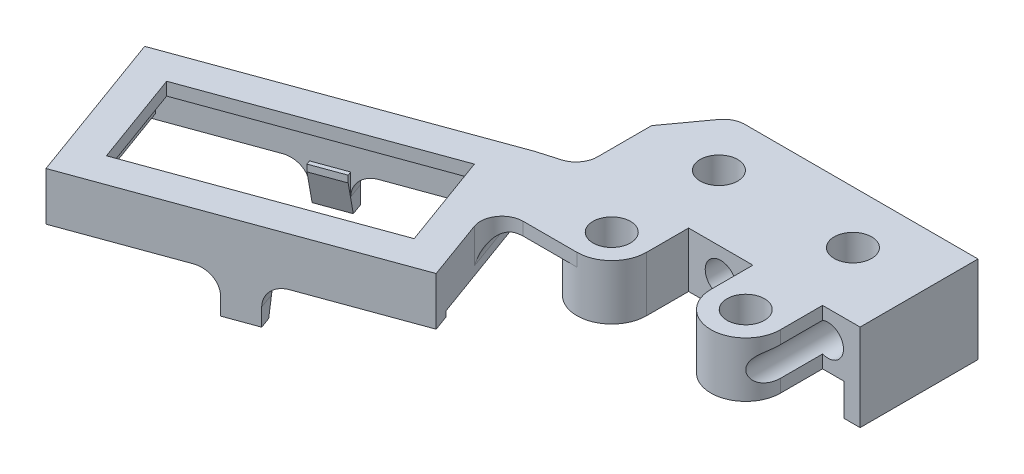
from build123d import *
from OCP.BRepFilletAPI import BRepFilletAPI_MakeChamfer

# Parameters (mm, degrees)
SKETCH1_R           = 1.7499999999999998
BOSS_EXTRUDE1_DEPTH = 5.13
CUT_EXTRUDE1_REACH  = 26.268
SKETCH2_R           = 1.45
BOSS_EXTRUDE2_DEPTH = 3
CUT_EXTRUDE2_REACH  = 20.262
CUT_EXTRUDE3_REACH  = 20.262
BOSS_EXTRUDE3_START = 1.2
BOSS_EXTRUDE3_DEPTH = 1.2
BOSS_EXTRUDE6_DEPTH = 3.3
BOSS_EXTRUDE7_DEPTH = 0.8
CUT_EXTRUDE4_DEPTH  = 0.5
CUT_EXTRUDE5_REACH  = 52.896
BOSS_EXTRUDE8_DEPTH = 2.83
FILLET1_R           = 2
CHAMFER1_SIZE       = 3
CHAMFER1_SIZE2      = 0.8038475772933701


with BuildPart() as part:
    # Sketch1 → Boss-Extrude1 (new body)
    with BuildSketch(Plane(origin=(0, 0, 0), x_dir=(1, 0, 0), z_dir=(0, 1, 0))):
        Polygon((12.999999999999998, 9.92), (-13.000000000000002, 9.92), (-13, -9.92), (13, -9.92), align=None)
        with Locations((-6.250000000000001, -5)):
            Circle(SKETCH1_R, mode=Mode.SUBTRACT)
        with Locations((6.250000000000003, -4.999999999999995)):
            Circle(SKETCH1_R, mode=Mode.SUBTRACT)
        with Locations((-6.250000000000001, 5)):
            Circle(SKETCH1_R, mode=Mode.SUBTRACT)
        with Locations((6.249999999999999, 4.999999999999998)):
            Circle(SKETCH1_R, mode=Mode.SUBTRACT)
    extrude(amount=BOSS_EXTRUDE1_DEPTH)

    # Sketch2 → Cut-Extrude1 (cut, up to next)
    with BuildSketch(Plane.XY.offset(9.92), mode=Mode.PRIVATE) as cut_extrude1_sk1:
        with Locations((0, 2.565)):
            Circle(SKETCH2_R)
    cut_extrude1_tool1 = extrude(cut_extrude1_sk1.sketch, amount=-CUT_EXTRUDE1_REACH, mode=Mode.PRIVATE) & part.part
    # Sketch2 → Cut-Extrude1 (cut, up to next)
    with BuildSketch(Plane.XY.offset(9.92), mode=Mode.PRIVATE) as cut_extrude1_sk2:
        with Locations((-10, 2.565)):
            Circle(SKETCH2_R)
    cut_extrude1_tool2 = extrude(cut_extrude1_sk2.sketch, amount=-CUT_EXTRUDE1_REACH, mode=Mode.PRIVATE) & part.part
    # Sketch2 → Cut-Extrude1 (cut, up to next)
    with BuildSketch(Plane.XY.offset(9.92), mode=Mode.PRIVATE) as cut_extrude1_sk3:
        with Locations((10, 2.565)):
            Circle(SKETCH2_R)
    cut_extrude1_tool3 = extrude(cut_extrude1_sk3.sketch, amount=-CUT_EXTRUDE1_REACH, mode=Mode.PRIVATE) & part.part
    add(cut_extrude1_tool1.solids().sort_by_distance((0, 2.565, 9.92))[0], mode=Mode.SUBTRACT)
    add(cut_extrude1_tool2.solids().sort_by_distance((-10, 2.565, 9.92))[0], mode=Mode.SUBTRACT)
    add(cut_extrude1_tool3.solids().sort_by_distance((10, 2.565, 9.92))[0], mode=Mode.SUBTRACT)

    # Sketch3 → Boss-Extrude2 (add)
    with BuildSketch(Plane.XZ):
        with BuildLine():
            Line((-13, -9.919999999999998), (-11.034999999999997, -9.919999999999998))
            Line((-11.034999999999997, -9.92), (-11.63, 3.710000000000001))
            add(Edge.make_bspline(
                [(-11.63, 3.7100000000000013), (-10.51224572230246, 4.466321985960096), (-10.92, 6.040000000000002)],
                knots=[0, 0, 0, 1, 1, 1], degree=2))
            Line((-10.92, 6.040000000000002), (-9.0061377245509, 9.92))
            Line((-9.0061377245509, 9.92), (-13.000000000000002, 9.92))
            Line((-13.000000000000002, 9.92), (-13, -9.919999999999996))
        make_face()
        with BuildLine():
            Line((11.63, 3.7100000000000044), (11.035000000000004, -9.919999999999996))
            Line((11.035000000000004, -9.92), (13, -9.92))
            Line((12.999999999999998, -9.919999999999998), (12.999999999999995, 9.919999999999998))
            Line((12.999999999999995, 9.919999999999998), (9.006137724550902, 9.919999999999998))
            Line((9.0061377245509, 9.920000000000002), (10.92, 6.0400000000000045))
            add(Edge.make_bspline(
                [(11.63, 3.7100000000000044), (10.512245722302461, 4.466321985960101), (10.92, 6.0400000000000045)],
                knots=[0, 0, 0, 1, 1, 1], degree=2))
        make_face()
    extrude(amount=BOSS_EXTRUDE2_DEPTH)

    # Sketch4 → Cut-Extrude2 (cut, up to next)
    with BuildSketch(Plane.XZ.offset(3), mode=Mode.PRIVATE) as cut_extrude2_sk1:
        with BuildLine():
            Line((-13.000000000000002, 9.92), (-13.000000000000002, 1.0799999999999994))
            Line((-13.000000000000002, 1.0799999999999994), (-9.5, 1.0799999999999994))
            Line((-9.5, 1.0799999999999992), (-9.500000000000002, 5))
            ThreePointArc((-9.5, 4.999999999999999), (-6.250000000000002, 8.25), (-3.000000000000001, 5))
            Line((-3.000000000000001, 5), (-3.000000000000001, 1.0799999999999992))
            Line((-3.0000000000000018, 1.0799999999999994), (3.0000000000000018, 1.0799999999999994))
            Line((3.0000000000000027, 1.0799999999999992), (3.0000000000000036, 4.999999999999995))
            ThreePointArc((3.0000000000000027, 4.999999999999994), (6.250000000000002, 8.249999999999995), (9.500000000000004, 4.999999999999995))
            Line((9.500000000000002, 4.999999999999995), (9.500000000000002, 1.0799999999999992))
            Line((9.500000000000002, 1.0799999999999994), (12.999999999999998, 1.0799999999999994))
            Line((12.999999999999998, 1.08), (12.999999999999998, 9.92))
            Line((12.999999999999998, 9.92), (-13.000000000000002, 9.92))
        make_face()
    cut_extrude2_tool1 = extrude(cut_extrude2_sk1.sketch, amount=-CUT_EXTRUDE2_REACH, mode=Mode.PRIVATE) & part.part
    add(cut_extrude2_tool1.solids().sort_by_distance((0, -3, 6.160153))[0], mode=Mode.SUBTRACT)

    # Sketch5 → Cut-Extrude3 (cut, up to next)
    with BuildSketch(Plane(origin=(0, 5.13, 0), x_dir=(1, 0, 0), z_dir=(0, 1, 0)), mode=Mode.PRIVATE) as cut_extrude3_sk1:
        with BuildLine():
            Line((-13.000000000000002, 9.92), (-13.000000000000002, 5.470620579873407))
            Line((-13.000000000000002, 5.470620579873406), (-10.364706936690483, 9.097790307355663))
            ThreePointArc((-10.364706936690483, 9.097790307355663), (-9.696381549091774, 9.682348653991406), (-8.840876363794345, 9.92))
            Line((-8.840876363794345, 9.92), (-13.000000000000002, 9.92))
        make_face()
    cut_extrude3_tool1 = extrude(cut_extrude3_sk1.sketch, amount=-CUT_EXTRUDE3_REACH, mode=Mode.PRIVATE) & part.part
    add(cut_extrude3_tool1.solids().sort_by_distance((-11.876404, 5.13, -8.463849))[0], mode=Mode.SUBTRACT)

    # Sketch6 → Boss-Extrude3 (add)
    with BuildSketch(Plane.XZ.offset(-5.13).offset(BOSS_EXTRUDE3_START)):
        with BuildLine():
            Line((-11.098405421888891, 16.531452984385147), (-37.78567585220869, 26.24482505483415))
            Line((-37.78567585220869, 26.24482505483415), (-43.05278605942399, 11.773558694731163))
            Line((-43.05278605942399, 11.773558694731163), (-16.36551562910419, 2.060186624282162))
            Line((-16.36551562910419, 2.060186624282161), (-13.000000000000002, 1.0799999999999994))
            Line((-13.000000000000002, 1.0799999999999994), (-9.500000000000002, 1.0799999999999994))
            Line((-9.500000000000002, 1.0799999999999992), (-9.500000000000002, 5))
            ThreePointArc((-9.500000000000002, 5), (-8.54809703885628, 7.29809703885628), (-6.250000000000001, 8.25))
            Line((-6.250000000000001, 8.25), (-14.1126078046801, 8.249999999999998))
            Line((-14.112607804680097, 8.249999999999996), (-11.098405421888893, 16.531452984385147))
        make_face()
    extrude(amount=-BOSS_EXTRUDE3_DEPTH)

    # Sketch9 → Boss-Extrude6 (add)
    with BuildSketch(Plane.XZ.offset(-3.93)):
        Polygon((-43.052786059423994, 11.773558694731161), (-37.78567585220869, 26.244825054834152), (-11.098405421888893, 16.531452984385147), (-16.36551562910419, 2.060186624282161), align=None)
        Polygon((-41.13021691325663, 12.670067410921524), (-17.262024345294552, 3.982755770449528), (-13.020974568056255, 15.63494426819479), (-36.88916713601834, 24.32225590866679), align=None, mode=Mode.SUBTRACT)
    extrude(amount=BOSS_EXTRUDE6_DEPTH)

    # Sketch10 → Boss-Extrude7 (add)
    with BuildSketch(Plane.XZ.offset(-0.6300000000000003)):
        Polygon((-31.118689775442956, 7.429902874495164), (-28.299611913085236, 6.403842444518162), (-27.64977364076646, 8.189258424011385), (-30.46885150312418, 9.215318853988391), align=None)
        Polygon((-25.85157956822766, 21.901169234598154), (-23.032501705869944, 20.875108804621146), (-23.68233997818871, 19.089692825127923), (-26.50141784054643, 20.115753255104927), align=None)
    extrude(amount=BOSS_EXTRUDE7_DEPTH)

    # Sketch11 → Cut-Extrude4 (cut)
    with BuildSketch(Plane.XZ.offset(-0.6300000000000003)):
        Polygon((-17.262024345294552, 3.982755770449528), (-13.020974568056257, 15.634944268194793), (-11.611435636877394, 15.12191405320629), (-15.852485414115685, 3.469725555461025), align=None)
        Polygon((-36.889167136018344, 24.322255908666797), (-41.13021691325663, 12.670067410921524), (-42.53975584443549, 13.183097625910026), (-38.298706067197195, 24.835286123655298), align=None)
    extrude(amount=-CUT_EXTRUDE4_DEPTH, mode=Mode.SUBTRACT)

    # Sketch12 → Cut-Extrude5 (cut, up to next)
    with BuildSketch(Plane.XZ.offset(-3.93), mode=Mode.PRIVATE) as cut_extrude5_sk1:
        Polygon((-14.94354371422362, 14.738435552004432), (-35.99265841982798, 22.399686762499428), (-39.20764776708926, 13.566576127111883), (-18.15853306148491, 5.9053249166168955), align=None)
    cut_extrude5_tool1 = extrude(cut_extrude5_sk1.sketch, amount=-CUT_EXTRUDE5_REACH, mode=Mode.PRIVATE) & part.part
    add(cut_extrude5_tool1.solids().sort_by_distance((-27.075596, 3.93, 14.152506))[0], mode=Mode.SUBTRACT)

    # Sketch13 → Boss-Extrude8 (add)
    with BuildSketch(Plane.XZ.offset(0.16999999999999968)):
        Polygon((-30.46885150312418, 9.215318853988391), (-31.118689775442956, 7.429902874495164), (-28.299611913085236, 6.403842444518162), (-27.64977364076646, 8.189258424011385), align=None)
        Polygon((-25.85157956822766, 21.901169234598154), (-26.50141784054643, 20.115753255104927), (-23.68233997818871, 19.089692825127923), (-23.032501705869944, 20.875108804621146), align=None)
    extrude(amount=BOSS_EXTRUDE8_DEPTH)

    # Fillet1
    fillet1_edges = [part.edges().sort_by_distance(p)[0] for p in [
        (-30.862174667948704, 0.6300000000000003, 8.134672340084595),
        (-26.10809467572191, 0.6300000000000003, 21.196399769008725),
        (-23.289016813364192, 0.6300000000000003, 20.170339339031717),
        (-28.04309680559098, 0.6300000000000003, 7.108611910107593),
        (-13.000000000000002, 4.529999999999999, 1.0799999999999994),
        (-14.1126078046801, 4.529999999999999, 8.249999999999996),
        (-15.239061716892145, 3.93, 5.155093312141078),
    ]]
    fillet(fillet1_edges, radius=FILLET1_R)

    # Chamfer1: one chamfer whose edges measure the first distance from different faces: ONE call of the kernel's chamfer builder (chamfer() names one face for all edges)
    chamfer1_edges_1 = [part.edges().sort_by_distance(p)[0] for p in [
        (-25.091878909367573, -2.9999999999999996, 19.602723040116423),
    ]]
    chamfer1_side_1 = [part.faces().sort_by_distance(p)[0] for p in [
        (-25.091878909367573, -1.1849999999999996, 19.602723040116427),
    ]]
    chamfer1_edges_2 = [part.edges().sort_by_distance(p)[0] for p in [
        (-29.05931257194532, -2.9999999999999996, 8.702288638999889),
    ]]
    chamfer1_side_2 = [part.faces().sort_by_distance(p)[0] for p in [
        (-29.059312571945316, -1.1849999999999996, 8.702288638999887),
    ]]
    chamfer1 = BRepFilletAPI_MakeChamfer(part.part.solid().wrapped)
    for e in chamfer1_edges_1:
        chamfer1.Add(CHAMFER1_SIZE, CHAMFER1_SIZE2, e.wrapped, chamfer1_side_1[0].wrapped)  # the first distance lies on this face
    for e in chamfer1_edges_2:
        chamfer1.Add(CHAMFER1_SIZE, CHAMFER1_SIZE2, e.wrapped, chamfer1_side_2[0].wrapped)  # the first distance lies on this face
    add(Compound.cast(chamfer1.Shape()), mode=Mode.REPLACE)


solid = part.part
